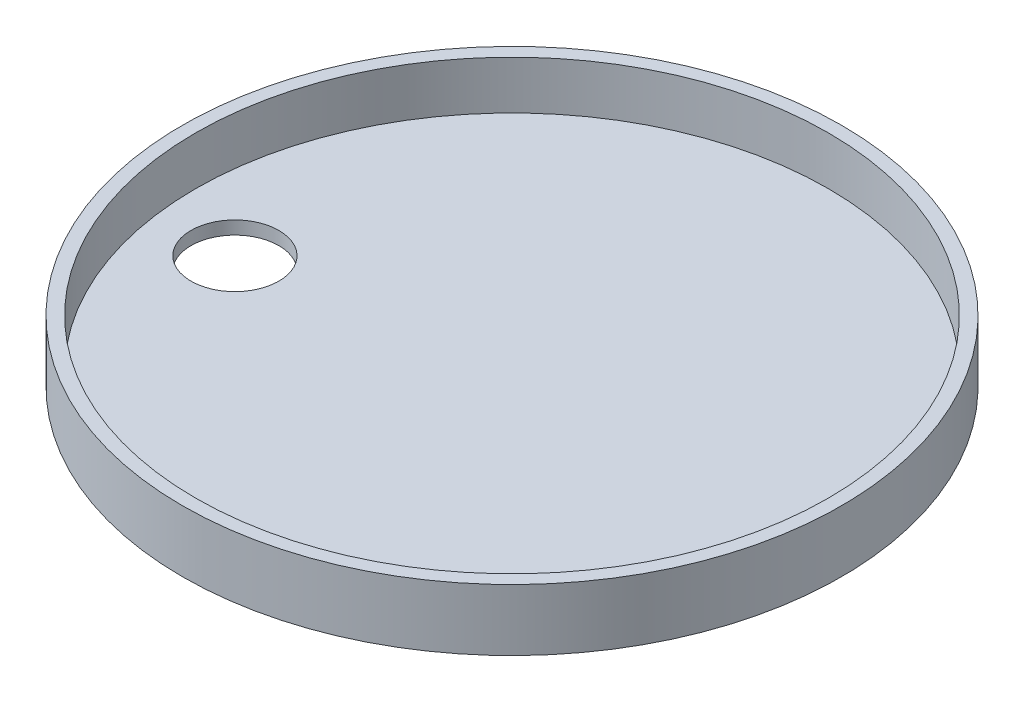
from build123d import *

# Parameters (mm, degrees)
SKETCH1_R           = 95.25
BOSS_EXTRUDE1_DEPTH = 3.81
SKETCH2_R           = 95.25
SKETCH2_R_2         = 91.44
BOSS_EXTRUDE2_DEPTH = 13.97
HOLE1_OUTLINE_R     = 12.7
HOLE1_DEPTH         = 3.81


# Read off the part's stored shape, not the designer's step: Hole1
with BuildPart() as part:
    # Sketch1 → Boss-Extrude1 (new body)
    with BuildSketch(Plane(origin=(0, 0, 0), x_dir=(1, 0, 0), z_dir=(0, 1, 0))):
        with Locations(Location((0, 0, 0), (0, 0, 90))):
            Circle(SKETCH1_R)
    extrude(amount=BOSS_EXTRUDE1_DEPTH)

    # Sketch2 → Boss-Extrude2 (add)
    with BuildSketch(Plane(origin=(0, 3.81, 0), x_dir=(1, 0, 0), z_dir=(0, 1, 0))):
        with Locations(Location((0, 0, 0), (0, 0, 90))):
            Circle(SKETCH2_R)
        with Locations(Location((0, 0, 0), (0, 0, 270))):
            Circle(SKETCH2_R_2, mode=Mode.SUBTRACT)
    extrude(amount=BOSS_EXTRUDE2_DEPTH)

    # Hole1 outline → Hole1 (cut)
    with BuildSketch(Plane(origin=(0, 0, 0), x_dir=(1, 0, 0), z_dir=(0, 1, 0))):
        with Locations((-68.958152294, -11.126353047)):
            Circle(HOLE1_OUTLINE_R)
    extrude(amount=HOLE1_DEPTH, mode=Mode.SUBTRACT)


solid = part.part
